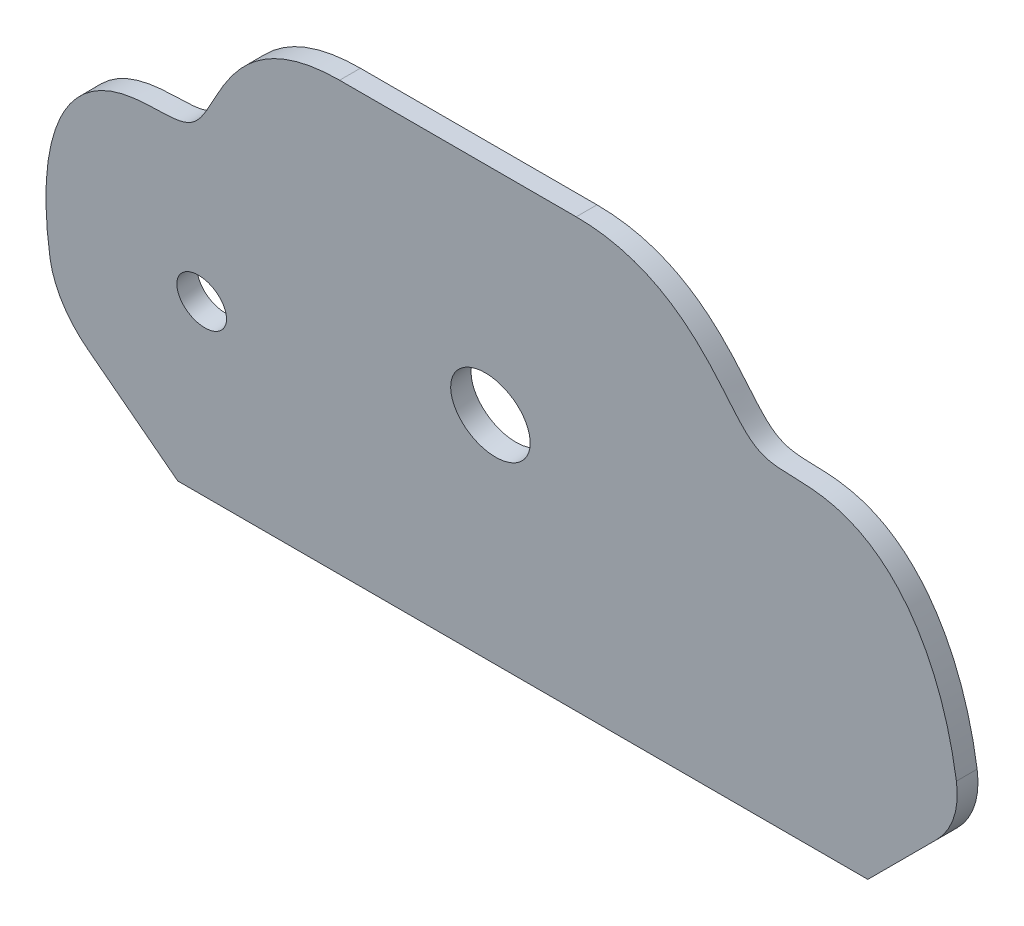
from build123d import *

# Parameters (mm, degrees)
BOSS_EXTRUDE1_START     = -25
BOSS_EXTRUDE1_DEPTH     = 50
CUT_EXTRUDE1_DEPTH      = 341.53226913
CUT_EXTRUDE1_DEPTH_BACK = 341.53226913
CUT_EXTRUDE2_DEPTH      = 341.286795308
CUT_EXTRUDE2_DEPTH_BACK = 341.286795308
SKETCH4_R               = 20
CUT_EXTRUDE3_DEPTH      = 341.286795308
CUT_EXTRUDE3_DEPTH_BACK = 341.286795308
SKETCH6_R               = 12.5


# Read off the part's stored shape, not the designer's step: Boss-Extrude1
with BuildPart() as part:
    # Boss-Extrude1 outline → Boss-Extrude1 (new body)
    with BuildSketch(Plane.XY.offset(BOSS_EXTRUDE1_START)):
        with BuildLine():
            Line((175, 0), (215.218833807, 40.218833807))
            ThreePointArc((215.218833807, 40.218833807), (226.057471223, 56.440000887), (229.863494748, 75.574172084))
            add(Edge.make_bspline(
                [(229.863494748, 75.574172084), (229.863497015, 220.574172084), (130.657195822, 208), (130.657198498, 108), (160, 250), (60, 250)],
                knots=[0, 0, 0, 0, 0, 0, 1, 1, 1, 1, 1, 1], degree=5))
            Line((60, 250), (-60, 250))
            add(Edge.make_bspline(
                [(-60, 250), (-160, 250), (-130.657198498, 108), (-130.657195822, 208), (-229.863497015, 220.574172084), (-229.863494748, 75.574172084)],
                knots=[0, 0, 0, 0, 0, 0, 1, 1, 1, 1, 1, 1], degree=5))
            ThreePointArc((-229.863494748, 75.574172084), (-226.057471223, 56.440000887), (-215.218833807, 40.218833807))
            Line((-215.218833807, 40.218833807), (-175, 0))
            Line((-175, 0), (175, 0))
        make_face()
    extrude(amount=BOSS_EXTRUDE1_DEPTH)

    # Sketch2 → Cut-Extrude1 (cut, two sides: drawn at the far end of the back side and taken through both)
    with BuildSketch(Plane(origin=(0, 0, 0), x_dir=(0, 0, -1), z_dir=(1, 0, 0)).offset(-CUT_EXTRUDE1_DEPTH_BACK)):
        Polygon((23.039732542, -10), (-12.506441807, 260), (35, 260), (35, -10), align=None)
        Polygon((-23.039732542, 260), (12.506441807, -10), (-35, -10), (-35, 260), align=None)
    extrude(amount=CUT_EXTRUDE1_DEPTH + CUT_EXTRUDE1_DEPTH_BACK, mode=Mode.SUBTRACT)

    # Sketch4 → Cut-Extrude2 (cut, two sides: drawn at the far end of the back side and taken through both)
    with BuildSketch(Plane(origin=(0, 2.811189919, -21.353107392), x_dir=(-1, 0, 0), z_dir=(0, 0.13052619222005532, -0.99144486137381)).offset(-CUT_EXTRUDE2_DEPTH_BACK)):
        with Locations(Location((0, 124.321792579, 0), (0, 0, 90))):
            Circle(SKETCH4_R)
    extrude(amount=CUT_EXTRUDE2_DEPTH + CUT_EXTRUDE2_DEPTH_BACK, mode=Mode.SUBTRACT)

    # Sketch6 → Cut-Extrude3 (cut, two sides: drawn at the far end of the back side and taken through both)
    with BuildSketch(Plane(origin=(0, 2.811189919, -21.353107392), x_dir=(-1, 0, 0), z_dir=(0, 0.13052619222005532, -0.99144486137381)).offset(-CUT_EXTRUDE3_DEPTH_BACK)):
        with Locations(Location((150, 97.164552434, 0), (0, 0, 90))):
            Circle(SKETCH6_R)
    extrude(amount=CUT_EXTRUDE3_DEPTH + CUT_EXTRUDE3_DEPTH_BACK, mode=Mode.SUBTRACT)


solid = part.part
